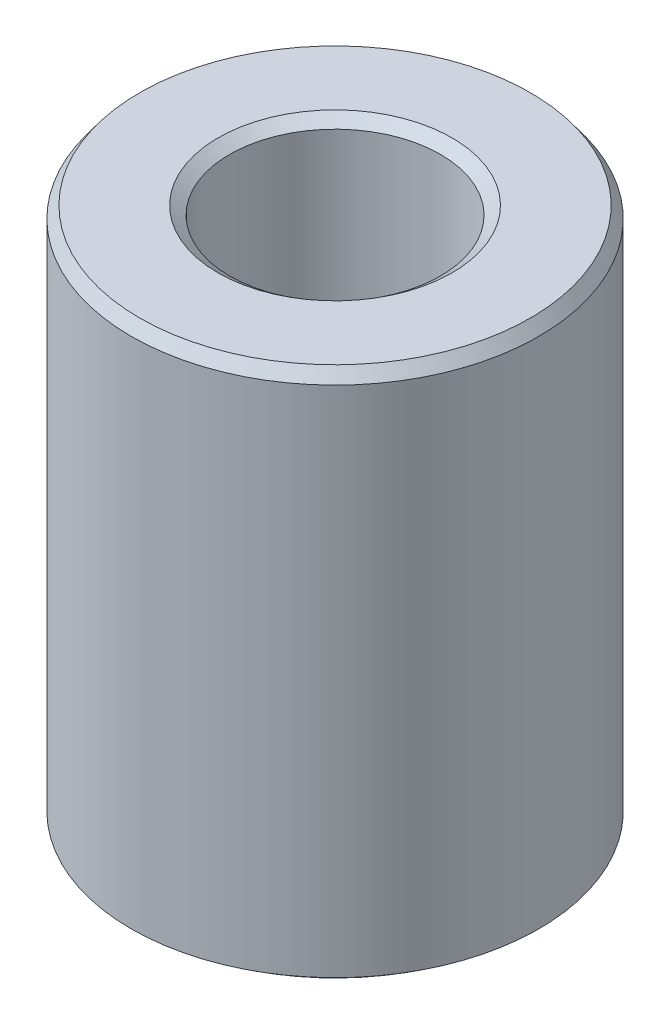
from build123d import *
from OCP.BRepFilletAPI import BRepFilletAPI_MakeChamfer

# Parameters (mm, degrees)
SKETCH1_R           = 25
BOSS_EXTRUDE1_DEPTH = 65.419150205
SKETCH2_R           = 12.929180662
CUT_EXTRUDE1_DEPTH  = 75.361718737
CHAMFER1_SIZE       = 1.423014023
CHAMFER1_SIZE2      = 1.044705848


with BuildPart() as part:
    # Sketch1 → Boss-Extrude1 (new body)
    with BuildSketch(Plane(origin=(0, 0, 0), x_dir=(1, 0, 0), z_dir=(0, 1, 0))):
        Circle(SKETCH1_R)
    extrude(amount=BOSS_EXTRUDE1_DEPTH)

    # Sketch2 → Cut-Extrude1 (cut, through all)
    with BuildSketch(Plane(origin=(0, 0, 0), x_dir=(1, 0, 0), z_dir=(0, 1, 0))):
        Circle(SKETCH2_R)
    extrude(amount=CUT_EXTRUDE1_DEPTH, mode=Mode.SUBTRACT)

    # Chamfer1: one chamfer whose edges measure the first distance from different faces: ONE call of the kernel's chamfer builder (chamfer() names one face for all edges)
    chamfer1_edges_1 = [part.edges().sort_by_distance(p)[0] for p in [
        (-12.929180662, 65.419150205, 0),
    ]]
    chamfer1_side_1 = [part.faces().sort_by_distance(p)[0] for p in [
        (-24.292893219, 65.419150205, 0),
    ]]
    chamfer1_edges_2 = [part.edges().sort_by_distance(p)[0] for p in [
        (-12.929180662, 0, 0),
    ]]
    chamfer1_side_2 = [part.faces().sort_by_distance(p)[0] for p in [
        (-12.929180662, 32.709575102, 0),
    ]]
    chamfer1_edges_3 = [part.edges().sort_by_distance(p)[0] for p in [
        (-25, 0, 0),
    ]]
    chamfer1_side_3 = [part.faces().sort_by_distance(p)[0] for p in [
        (-24.292893219, 0, 0),
    ]]
    chamfer1_edges_4 = [part.edges().sort_by_distance(p)[0] for p in [
        (-25, 65.419150205, 0),
    ]]
    chamfer1_side_4 = [part.faces().sort_by_distance(p)[0] for p in [
        (-25, 32.709575102, 0),
    ]]
    chamfer1 = BRepFilletAPI_MakeChamfer(part.part.solid().wrapped)
    for e in chamfer1_edges_1:
        chamfer1.Add(CHAMFER1_SIZE, CHAMFER1_SIZE2, e.wrapped, chamfer1_side_1[0].wrapped)  # the first distance lies on this face
    for e in chamfer1_edges_2:
        chamfer1.Add(CHAMFER1_SIZE, CHAMFER1_SIZE2, e.wrapped, chamfer1_side_2[0].wrapped)  # the first distance lies on this face
    for e in chamfer1_edges_3:
        chamfer1.Add(CHAMFER1_SIZE, CHAMFER1_SIZE2, e.wrapped, chamfer1_side_3[0].wrapped)  # the first distance lies on this face
    for e in chamfer1_edges_4:
        chamfer1.Add(CHAMFER1_SIZE, CHAMFER1_SIZE2, e.wrapped, chamfer1_side_4[0].wrapped)  # the first distance lies on this face
    add(Compound.cast(chamfer1.Shape()), mode=Mode.REPLACE)


solid = part.part
